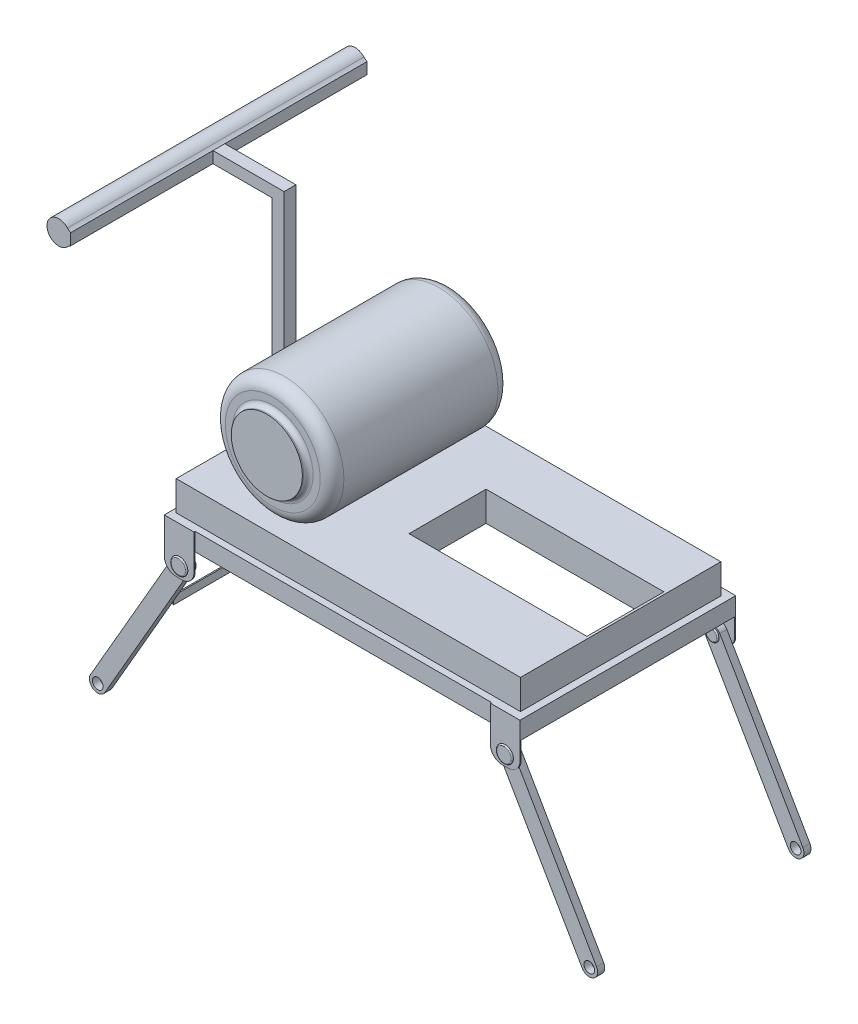
from build123d import *

# Parameters (mm, degrees)
SKETCH1_W                 = 300
SKETCH1_H                 = 15
BOSS_EXTRUDE1_DEPTH       = 180
SKETCH2_W                 = 276.393153848
SKETCH2_H                 = 159.056437592
CUT_EXTRUDE1_DEPTH        = 180
SKETCH3_W                 = 288.387573732
SKETCH3_H                 = 168.964871408
BOSS_EXTRUDE2_DEPTH       = 25
BOSS_EXTRUDE3_DEPTH       = 1
BOSS_EXTRUDE4_START       = 1
BOSS_EXTRUDE4_DEPTH       = 1
SKETCH6_R                 = 5
CUT_EXTRUDE2_DEPTH        = 200
SKETCH7_R                 = 4.8
SKETCH7_R_2               = 4.5
BOSS_EXTRUDE5_DEPTH       = 6
BOSS_EXTRUDE6_START       = 6
SKETCH8_R                 = 4.5
BOSS_EXTRUDE6_DEPTH       = 6
BOSS_EXTRUDE13_START      = 1
SKETCH15_R                = 7
BOSS_EXTRUDE13_DEPTH      = 1
FILLET2_R                 = 1
FILLET3_R                 = 1
SKETCH16_R                = 7.5
BOSS_EXTRUDE14_DEPTH      = 1
FILLET4_R                 = 1
SKETCH17_R                = 5.5
BOSS_EXTRUDE15_DEPTH      = 1
FILLET5_R                 = 1
BOSS_EXTRUDE16_START      = 1
SKETCH18_R                = 5.5
BOSS_EXTRUDE16_DEPTH      = 1
FILLET6_R                 = 1
SKETCH25_W                = 168.964871408
SKETCH25_H                = 25
BOSS_EXTRUDE22_DEPTH      = 2
SKETCH28_W                = 10
SKETCH28_H                = 10
BOSS_EXTRUDE25_DEPTH      = 175
SKETCH33_W                = 17.452069939
SKETCH33_H                = 31.073197695
BOSS_EXTRUDE27_DEPTH      = 15
FILLET7_R                 = 5
EXTRUDE_THIN3_DEPTH       = 5
EXTRUDE_THIN3_DEPTH_BACK  = 35
SKETCH34_R                = 2
SKETCH34_R_2              = 1.5
SKETCH35_W                = 2.832524323
SKETCH35_H                = 4.052008071
SKETCH35_R                = 0.8
SKETCH35_W_2              = 2.769934418
BOSS_EXTRUDE28_DEPTH      = 0.5
SKETCH36_R                = 1.5
BOSS_EXTRUDE29_DEPTH      = 14
SKETCH38_R                = 50
BOSS_EXTRUDE31_DEPTH      = 150
SKETCH39_R                = 30
BOSS_EXTRUDE32_DEPTH      = 5
BOSS_EXTRUDE33_START      = 5
SKETCH40_R                = 30
BOSS_EXTRUDE33_DEPTH      = 5
FILLET8_R                 = 10
FILLET9_R                 = 4
SKETCH41_W                = 150
SKETCH41_H                = 65
CUT_EXTRUDE5_DEPTH        = 40
SKETCH43_W                = 10
SKETCH43_H                = 9.605315656
BOSS_EXTRUDE34_DEPTH      = 50
BOSS_EXTRUDE35_DEPTH      = 120
BOSS_EXTRUDE35_DEPTH_BACK = 130
SKETCH45_R                = 3
CUT_EXTRUDE6_DEPTH        = 5
SKETCH46_W                = 168
SKETCH46_H                = 6.623509441
BOSS_EXTRUDE36_DEPTH      = 1
SKETCH47_W                = 13
SKETCH47_H                = 6.623509441
BOSS_EXTRUDE37_DEPTH      = 15


with BuildPart() as part:
    # Sketch1 → Boss-Extrude1 (new body)
    with BuildSketch(Plane.XY):
        with Locations((48.043406306, 18.498679245)):
            Rectangle(SKETCH1_W, SKETCH1_H)
    extrude(amount=-BOSS_EXTRUDE1_DEPTH)

    # Sketch2 → Cut-Extrude1 (cut)
    with BuildSketch(Plane(origin=(0, 25.998679245, 0), x_dir=(1, 0, 0), z_dir=(0, 1, 0))):
        with Locations((47.521909789, 90.260748258)):
            Rectangle(SKETCH2_W, SKETCH2_H)
    extrude(amount=-CUT_EXTRUDE1_DEPTH, mode=Mode.SUBTRACT)

    # Sketch3 → Boss-Extrude2 (add)
    with BuildSketch(Plane(origin=(0, 25.998679245, 0), x_dir=(1, 0, 0), z_dir=(0, 1, 0))):
        with Locations((47.782658048, 90)):
            Rectangle(SKETCH3_W, SKETCH3_H)
    extrude(amount=BOSS_EXTRUDE2_DEPTH)

    # Sketch4 → Boss-Extrude3 (add)
    with BuildSketch(Plane.XY):
        with BuildLine():
            Line((173.043406306, 25.998679245), (173.043406306, -4.001320755))
            ThreePointArc((173.043406306, -4.001320755), (175.972338494, -11.072388567), (183.043406306, -14.001320755))
            Line((183.043406306, -14.001320755), (188.043406306, -14.001320755))
            ThreePointArc((188.043406306, -14.001320755), (195.114474118, -11.072388567), (198.043406306, -4.001320755))
            Line((198.043406306, -4.001320755), (198.043406306, 25.998679245))
            Line((198.043406306, 25.998679245), (173.043406306, 25.998679245))
        make_face()
        with BuildLine():
            Line((-101.956593694, 25.998679245), (-76.956593694, 25.998679245))
            Line((-76.956593694, 25.998679245), (-76.956593694, -4.001320755))
            ThreePointArc((-76.956593694, -4.001320755), (-79.885525882, -11.072388567), (-86.956593694, -14.001320755))
            Line((-86.956593694, -14.001320755), (-91.956593694, -14.001320755))
            ThreePointArc((-91.956593694, -14.001320755), (-99.027661506, -11.072388567), (-101.956593694, -4.001320755))
            Line((-101.956593694, -4.001320755), (-101.956593694, 25.998679245))
        make_face()
    extrude(amount=BOSS_EXTRUDE3_DEPTH)

    # Sketch5 → Boss-Extrude4 (add)
    with BuildSketch(Plane(origin=(0, 0, -180), x_dir=(-1, 0, 0), z_dir=(0, 0, -1)).offset(BOSS_EXTRUDE4_START)):
        with BuildLine():
            Line((-173.043406306, 25.998679245), (-173.043406306, -4.001320755))
            ThreePointArc((-173.043406306, -4.001320755), (-175.972338494, -11.072388567), (-183.043406306, -14.001320755))
            Line((-183.043406306, -14.001320755), (-188.043406306, -14.001320755))
            ThreePointArc((-188.043406306, -14.001320755), (-195.114474118, -11.072388567), (-198.043406306, -4.001320755))
            Line((-198.043406306, -4.001320755), (-198.043406306, 25.998679245))
            Line((-198.043406306, 25.998679245), (-173.043406306, 25.998679245))
        make_face()
        with BuildLine():
            Line((76.576694111, 26.008778741), (101.576694111, 26.008778741))
            Line((101.576694111, 26.008778741), (101.576694111, -3.991221259))
            ThreePointArc((101.576694111, -3.991221259), (98.647761923, -11.062289071), (91.576694111, -13.991221259))
            Line((91.576694111, -13.991221259), (86.576694111, -13.991221259))
            ThreePointArc((86.576694111, -13.991221259), (79.5056263, -11.062289071), (76.576694111, -3.991221259))
            Line((76.576694111, -3.991221259), (76.576694111, 26.008778741))
        make_face()
    extrude(amount=-BOSS_EXTRUDE4_DEPTH)

    # Sketch6 → Cut-Extrude2 (cut)
    with BuildSketch(Plane.XY.offset(1)):
        with Locations(Location((-89.076694111, -4.970985928, 0), (0, 0, 180))):
            Circle(SKETCH6_R)
        with Locations((185.543406306, -4.970985928)):
            Circle(SKETCH6_R)
    extrude(amount=-CUT_EXTRUDE2_DEPTH, mode=Mode.SUBTRACT)

    # Sketch7 → Boss-Extrude5 (add)
    # profile 1 of 2: a face of its own
    with BuildSketch(Plane(origin=(0, 0, 0), x_dir=(-1, 0, 0), z_dir=(0, 0, -1))):
        with BuildLine():
            Line((-179.48122848, -8.470985928), (-249.48122848, -129.714542458))
            ThreePointArc((-249.48122848, -129.714542458), (-259.043406306, -132.276720284), (-261.605584133, -122.714542458))
            Line((-261.605584133, -122.714542458), (-191.605584133, -1.470985928))
            ThreePointArc((-191.605584133, -1.470985928), (-182.043406306, 1.091191899), (-179.48122848, -8.470985928))
        make_face()
        with Locations((-185.543406306, -4.970985928)):
            Circle(SKETCH7_R, mode=Mode.SUBTRACT)
        with Locations((-255.543406306, -126.214542458)):
            Circle(SKETCH7_R_2, mode=Mode.SUBTRACT)
    # profile 2 of 2: a face of its own
    with BuildSketch(Plane(origin=(0, 0, 0), x_dir=(-1, 0, 0), z_dir=(0, 0, -1))):
        with BuildLine():
            Line((95.138871938, -1.470985928), (165.138871938, -122.714542458))
            ThreePointArc((165.138871938, -122.714542458), (162.576694111, -132.276720284), (153.014516285, -129.714542458))
            Line((153.014516285, -129.714542458), (83.014516285, -8.470985928))
            ThreePointArc((83.014516285, -8.470985928), (85.576694111, 1.091191899), (95.138871938, -1.470985928))
        make_face()
        with Locations((89.076694111, -4.970985928)):
            Circle(SKETCH7_R_2, mode=Mode.SUBTRACT)
        with Locations((159.076694111, -126.214542458)):
            Circle(SKETCH7_R_2, mode=Mode.SUBTRACT)
    extrude(amount=BOSS_EXTRUDE5_DEPTH)

    # Sketch8 → Boss-Extrude6 (add)
    # profile 1 of 2: a face of its own
    with BuildSketch(Plane.XY.offset(-180).offset(BOSS_EXTRUDE6_START)):
        with BuildLine():
            Line((-83.014516285, -8.470985928), (-153.014516285, -129.714542458))
            ThreePointArc((-153.014516285, -129.714542458), (-162.576694111, -132.276720284), (-165.138871938, -122.714542458))
            Line((-165.138871938, -122.714542458), (-95.138871938, -1.470985928))
            ThreePointArc((-95.138871938, -1.470985928), (-85.576694111, 1.091191899), (-83.014516285, -8.470985928))
        make_face()
        with Locations(Location((-89.076694111, -4.970985928, 0), (0, 0, 180))):
            Circle(SKETCH8_R, mode=Mode.SUBTRACT)
        with Locations(Location((-159.076694111, -126.214542458, 0), (0, 0, 180))):
            Circle(SKETCH8_R, mode=Mode.SUBTRACT)
    # profile 2 of 2: a face of its own
    with BuildSketch(Plane.XY.offset(-180).offset(BOSS_EXTRUDE6_START)):
        with BuildLine():
            Line((191.605584133, -1.470985928), (261.605584133, -122.714542458))
            ThreePointArc((261.605584133, -122.714542458), (259.043406306, -132.276720284), (249.48122848, -129.714542458))
            Line((249.48122848, -129.714542458), (179.48122848, -8.470985928))
            ThreePointArc((179.48122848, -8.470985928), (182.043406306, 1.091191899), (191.605584133, -1.470985928))
        make_face()
        with Locations((185.543406306, -4.970985928)):
            Circle(SKETCH8_R, mode=Mode.SUBTRACT)
        with Locations(Location((255.543406306, -126.214542458, 0), (0, 0, 180))):
            Circle(SKETCH8_R, mode=Mode.SUBTRACT)
    extrude(amount=-BOSS_EXTRUDE6_DEPTH)

    # Sketch15 → Boss-Extrude13 (add)
    with BuildSketch(Plane.XY.offset(1).offset(BOSS_EXTRUDE13_START)):
        with Locations(Location((185.543406306, -4.970985928, 0), (0, 0, 180))):
            Circle(SKETCH15_R)
        with Locations(Location((-89.076694111, -4.970985928, 0), (0, 0, 180))):
            Circle(SKETCH15_R)
    extrude(amount=-BOSS_EXTRUDE13_DEPTH)

    # Fillet2
    fillet2_edges = [part.edges().sort_by_distance(p)[0] for p in [
        (-82.076694111, -4.970985928, 2),
    ]]
    fillet(fillet2_edges, radius=FILLET2_R - 0.0001)  # a hair under: the kernel refuses the full size

    # Fillet3
    fillet3_edges = [part.edges().sort_by_distance(p)[0] for p in [
        (192.543406306, -4.970985928, 2),
    ]]
    fillet(fillet3_edges, radius=FILLET3_R - 0.0001)  # a hair under: the kernel refuses the full size

    # Sketch16 → Boss-Extrude14 (add)
    with BuildSketch(Plane(origin=(0, 0, -181), x_dir=(-1, 0, 0), z_dir=(0, 0, -1))):
        with Locations(Location((-185.543406306, -4.970985928, 0), (0, 0, 180))):
            Circle(SKETCH16_R)
        with Locations((89.076694111, -4.970985928)):
            Circle(SKETCH16_R)
    extrude(amount=BOSS_EXTRUDE14_DEPTH)

    # Fillet4
    fillet4_edges = [part.edges().sort_by_distance(p)[0] for p in [
        (178.043406306, -4.970985928, -182),
        (-81.576694111, -4.970985928, -182),
    ]]
    fillet(fillet4_edges, radius=FILLET4_R - 0.0001)  # a hair under: the kernel refuses the full size

    # Sketch17 → Boss-Extrude15 (add)
    with BuildSketch(Plane(origin=(0, 0, -6), x_dir=(-1, 0, 0), z_dir=(0, 0, -1))):
        with Locations((89.076694111, -4.970985928)):
            Circle(SKETCH17_R)
        with Locations((-185.543406306, -4.970985928)):
            Circle(SKETCH17_R)
    extrude(amount=BOSS_EXTRUDE15_DEPTH)

    # Fillet5
    fillet5_edges = [part.edges().sort_by_distance(p)[0] for p in [
        (-83.576694111, -4.970985928, -7),
        (191.043406306, -4.970985928, -7),
    ]]
    fillet(fillet5_edges, radius=FILLET5_R - 0.0001)  # a hair under: the kernel refuses the full size

    # Sketch18 → Boss-Extrude16 (add)
    with BuildSketch(Plane.XY.offset(-174).offset(BOSS_EXTRUDE16_START)):
        with Locations((-89.076694111, -4.970985928)):
            Circle(SKETCH18_R)
        with Locations((185.543406306, -4.970985928)):
            Circle(SKETCH18_R)
    extrude(amount=-BOSS_EXTRUDE16_DEPTH)

    # Fillet6
    fillet6_edges = [part.edges().sort_by_distance(p)[0] for p in [
        (-94.576694111, -4.970985928, -173),
        (180.043406306, -4.970985928, -173),
    ]]
    fillet(fillet6_edges, radius=FILLET6_R - 0.0001)  # a hair under: the kernel refuses the full size

    # Sketch25 → Boss-Extrude22 (add)
    with BuildSketch(Plane.ZY.offset(96.411128818)):
        with Locations((-90, 38.498679245)):
            Rectangle(SKETCH25_W, SKETCH25_H)
    extrude(amount=BOSS_EXTRUDE22_DEPTH)

    # Sketch28 → Boss-Extrude25 (add)
    with BuildSketch(Plane(origin=(0, 50.998679245, 0), x_dir=(1, 0, 0), z_dir=(0, 1, 0))):
        with Locations((-92.543760507, 90.645822389)):
            Rectangle(SKETCH28_W, SKETCH28_H)
    extrude(amount=BOSS_EXTRUDE25_DEPTH)

    # Sketch33 → Boss-Extrude27 (add)
    with BuildSketch(Plane(origin=(0, 50.998679245, 0), x_dir=(1, 0, 0), z_dir=(0, 1, 0))):
        with Locations((-65.851801155, 88.460322609)):
            Rectangle(SKETCH33_W, SKETCH33_H)
    extrude(amount=BOSS_EXTRUDE27_DEPTH)

    # Fillet7
    fillet7_edges = [part.edges().sort_by_distance(p)[0] for p in [
        (-74.577836125, 65.998679245, -88.460322609),
        (-57.125766186, 65.998679245, -88.460322609),
    ]]
    fillet(fillet7_edges, radius=FILLET7_R)

    # Sketch34 → Extrude-Thin3 (add, two sides: drawn at the far end of the back side and taken through both)
    with BuildSketch(Plane.XY.offset(-72.923723761).offset(-EXTRUDE_THIN3_DEPTH_BACK)):
        with Locations((-66.560672874, 58.138888935)):
            Circle(SKETCH34_R)
        with Locations((-66.560672874, 58.138888935)):
            Circle(SKETCH34_R_2, mode=Mode.SUBTRACT)
    extrude(amount=EXTRUDE_THIN3_DEPTH + EXTRUDE_THIN3_DEPTH_BACK)

    # Sketch35 → Boss-Extrude28 (add)
    # profile 1 of 2: a face of its own
    with BuildSketch(Plane(origin=(0, 50.998679245, 0), x_dir=(1, 0, 0), z_dir=(0, 1, 0))):
        with Locations((-55.709504025, 88.859268641)):
            Rectangle(SKETCH35_W, SKETCH35_H)
        with Locations(Location((-55.688341255, 88.859268641, 0), (0, 0, 270))):
            Circle(SKETCH35_R, mode=Mode.SUBTRACT)
    # profile 2 of 2: a face of its own
    with BuildSketch(Plane(origin=(0, 50.998679245, 0), x_dir=(1, 0, 0), z_dir=(0, 1, 0))):
        with Locations((-75.962803334, 88.859268641)):
            Rectangle(SKETCH35_W_2, SKETCH35_H)
        with Locations(Location((-75.962803334, 88.859268641, 0), (0, 0, 270))):
            Circle(SKETCH35_R, mode=Mode.SUBTRACT)
    extrude(amount=BOSS_EXTRUDE28_DEPTH)

    # Sketch36 → Boss-Extrude29 (add)
    with BuildSketch(Plane(origin=(-87.543760507, 0, 0), x_dir=(0, 0, -1), z_dir=(1, 0, 0))):
        with Locations(Location((90.398996209, 55.28829075, 0), (0, 0, 180))):
            Circle(SKETCH36_R)
    extrude(amount=BOSS_EXTRUDE29_DEPTH)

    # Sketch38 → Boss-Extrude31 (add)
    with BuildSketch(Plane.XY.offset(-15.517564296)):
        with Locations((-26.977315143, 101.321710991)):
            Circle(SKETCH38_R)
    extrude(amount=-BOSS_EXTRUDE31_DEPTH)

    # Sketch39 → Boss-Extrude32 (add)
    with BuildSketch(Plane.XY.offset(-15.517564296)):
        with Locations((-26.977315143, 101.321710991)):
            Circle(SKETCH39_R)
    extrude(amount=BOSS_EXTRUDE32_DEPTH)

    # Sketch40 → Boss-Extrude33 (add)
    with BuildSketch(Plane(origin=(0, 0, -165.517564296), x_dir=(-1, 0, 0), z_dir=(0, 0, -1)).offset(BOSS_EXTRUDE33_START)):
        with Locations(Location((26.977315143, 101.321710991, 0), (0, 0, 180))):
            Circle(SKETCH40_R)
    extrude(amount=-BOSS_EXTRUDE33_DEPTH)

    # Fillet8
    fillet8_edges = [part.edges().sort_by_distance(p)[0] for p in [
        (-76.977315143, 101.321710991, -165.517564296),
        (-76.977315143, 101.321710991, -15.517564296),
    ]]
    fillet(fillet8_edges, radius=FILLET8_R)

    # Fillet9
    fillet9_edges = [part.edges().sort_by_distance(p)[0] for p in [
        (-56.977315143, 101.321710991, -15.517564296),
        (-56.977315143, 101.321710991, -170.517564296),
    ]]
    fillet(fillet9_edges, radius=FILLET9_R)

    # Sketch41 → Cut-Extrude5 (cut)
    with BuildSketch(Plane(origin=(0, 50.998679245, 0), x_dir=(1, 0, 0), z_dir=(0, 1, 0))):
        with Locations((114.980302076, 95.995198142)):
            Rectangle(SKETCH41_W, SKETCH41_H)
    extrude(amount=-CUT_EXTRUDE5_DEPTH, mode=Mode.SUBTRACT)

    # Sketch43 → Boss-Extrude34 (add)
    with BuildSketch(Plane.ZY.offset(97.543760507)):
        with Locations((-90.645822389, 221.196021417)):
            Rectangle(SKETCH43_W, SKETCH43_H)
    extrude(amount=BOSS_EXTRUDE34_DEPTH)

    # Sketch44 → Boss-Extrude35 (add, two sides: drawn at the far end of the back side and taken through both)
    with BuildSketch(Plane.XY.offset(-85.645822389).offset(-BOSS_EXTRUDE35_DEPTH_BACK)):
        with BuildLine():
            Line((-147.543760507, 216.393363589), (-147.543760507, 225.998679245))
            ThreePointArc((-147.543760507, 225.998679245), (-148.938020321, 226.918436272), (-150.212997369, 227.997485363))
            ThreePointArc((-150.212997369, 227.997485363), (-167.543760507, 221.196021417), (-150.212997369, 214.394557471))
            ThreePointArc((-150.212997369, 214.394557471), (-149.905636509, 214.80097816), (-149.559573386, 215.174995258))
            ThreePointArc((-149.559573386, 215.174995258), (-148.622341328, 215.901111491), (-147.543760507, 216.393363589))
        make_face()
    extrude(amount=BOSS_EXTRUDE35_DEPTH + BOSS_EXTRUDE35_DEPTH_BACK)

    # Sketch45 → Cut-Extrude6 (cut)
    with BuildSketch(Plane.ZY.offset(167.543760507)):
        with Locations((-188.476662496, 221.037768616)):
            Circle(SKETCH45_R)
        with Locations((-164.911857351, 221.037768616)):
            Circle(SKETCH45_R)
        with Locations((-141.074325045, 221.037768616)):
            Circle(SKETCH45_R)
        with Locations((-115.340625397, 221.037768616)):
            Circle(SKETCH45_R)
        with Locations((-86.898115259, 221.037768616)):
            Circle(SKETCH45_R)
        with Locations((-56.830318827, 221.037768616)):
            Circle(SKETCH45_R)
        with Locations((-26.762522396, 221.037768616)):
            Circle(SKETCH45_R)
        with Locations((2.22174984, 221.037768616)):
            Circle(SKETCH45_R)
    extrude(amount=-CUT_EXTRUDE6_DEPTH, mode=Mode.SUBTRACT)

    # Sketch46 → Boss-Extrude36 (add)
    with BuildSketch(Plane.ZY.offset(101.956593694)):
        with Locations((-90, -39.360381797)):
            Rectangle(SKETCH46_W, SKETCH46_H)
    extrude(amount=-BOSS_EXTRUDE36_DEPTH)

    # Sketch47 → Boss-Extrude37 (add)
    with BuildSketch(Plane.ZY.offset(101.956593694)):
        with Locations((-86.963945568, -39.360381797)):
            Rectangle(SKETCH47_W, SKETCH47_H)
    extrude(amount=BOSS_EXTRUDE37_DEPTH)


solid = part.part
